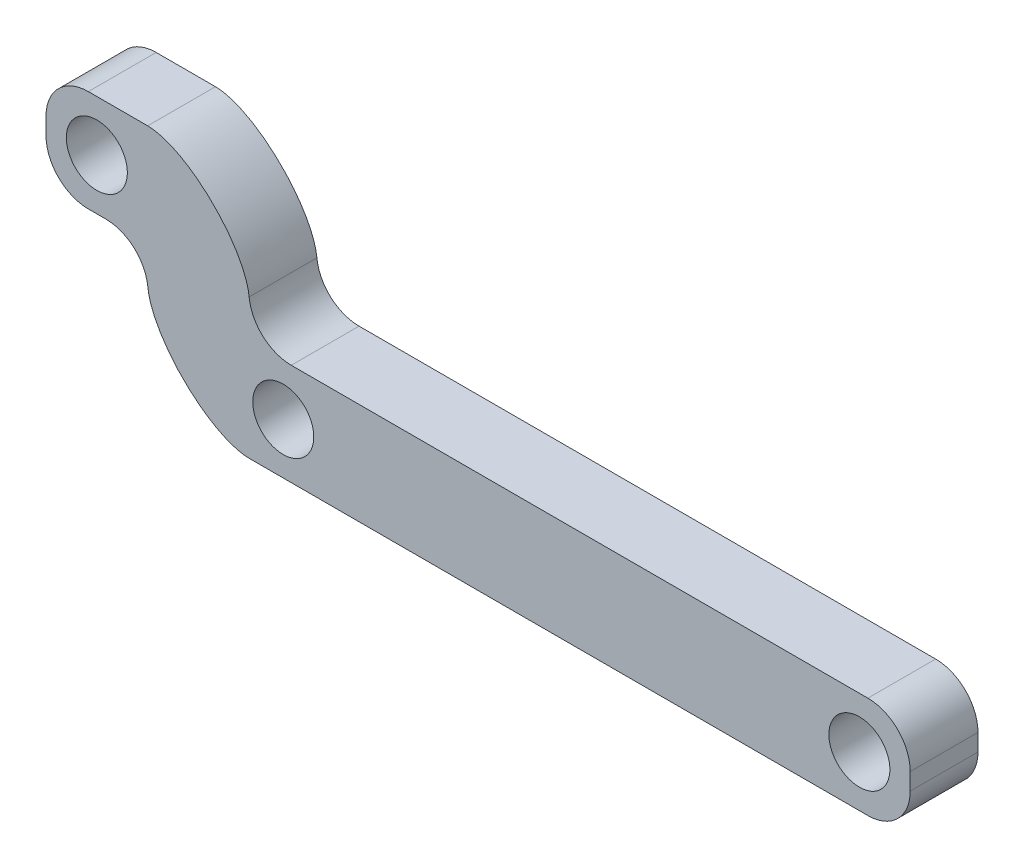
from build123d import *

# Parameters (mm, degrees)
SKETCH1_W           = 45
SKETCH1_H           = 6
SKETCH1_W_2         = 6
BOSS_EXTRUDE1_DEPTH = 4
SKETCH2_R           = 1.8
CUT_EXTRUDE1_DEPTH  = 52.778373864
FILLET2_SIZE        = 6
FILLET3_R           = 2.5


with BuildPart() as part:
    # Sketch1 → Boss-Extrude1 (new body)
    with BuildSketch(Plane.XY):
        with Locations((-22.5, -3)):
            Rectangle(SKETCH1_W, SKETCH1_H)
        Polygon((-45, 0), (-39, 0), (-39, 8), (-45, 8), (-45, 2), align=None)
        with Locations((-48, 5)):
            Rectangle(SKETCH1_W_2, SKETCH1_H)
    extrude(amount=BOSS_EXTRUDE1_DEPTH)

    # Sketch2 → Cut-Extrude1 (cut, through all)
    with BuildSketch(Plane(origin=(0, 0, 0), x_dir=(-1, 0, 0), z_dir=(0, 0, -1))):
        with Locations((3, -3)):
            Circle(SKETCH2_R)
        with Locations((37, -3)):
            Circle(SKETCH2_R)
        with Locations((48, 5)):
            Circle(SKETCH2_R)
    extrude(amount=-CUT_EXTRUDE1_DEPTH, mode=Mode.SUBTRACT)

    # Fillet2
    # a fillet whose section is not a circle: 6 mm, written as the material it takes off along each edge
    with BuildSketch(Plane(origin=(-45, -6, -15), x_dir=(1, 0, 0), z_dir=(0, 0, 1))) as fillet2_piece_1:
        with BuildLine():
            Bezier((FILLET2_SIZE, 0), (0, 0), (0, FILLET2_SIZE), weights=[1, 0.428571429, 1])
            Line((0, FILLET2_SIZE), (0, 0))
            Line((0, 0), (FILLET2_SIZE, 0))
        make_face()
    extrude(amount=34, mode=Mode.SUBTRACT)
    with BuildSketch(Plane(origin=(-39, 8, -15), x_dir=(0, -1, 0), z_dir=(0, 0, 1))) as fillet2_piece_2:
        with BuildLine():
            Bezier((FILLET2_SIZE, 0), (0, 0), (0, -FILLET2_SIZE), weights=[1, 0.428571429, 1])
            Line((0, -FILLET2_SIZE), (0, 0))
            Line((0, 0), (FILLET2_SIZE, 0))
        make_face()
    extrude(amount=34, mode=Mode.SUBTRACT)

    # Fillet3
    fillet3_edges = [part.edges().sort_by_distance(p)[0] for p in [
        (-51, 8, 2),
        (-51, 2, 2),
        (-45, 2, 2),
        (-39, 0, 2),
        (0, 0, 2),
        (0, -6, 2),
    ]]
    fillet(fillet3_edges, radius=FILLET3_R)


solid = part.part
